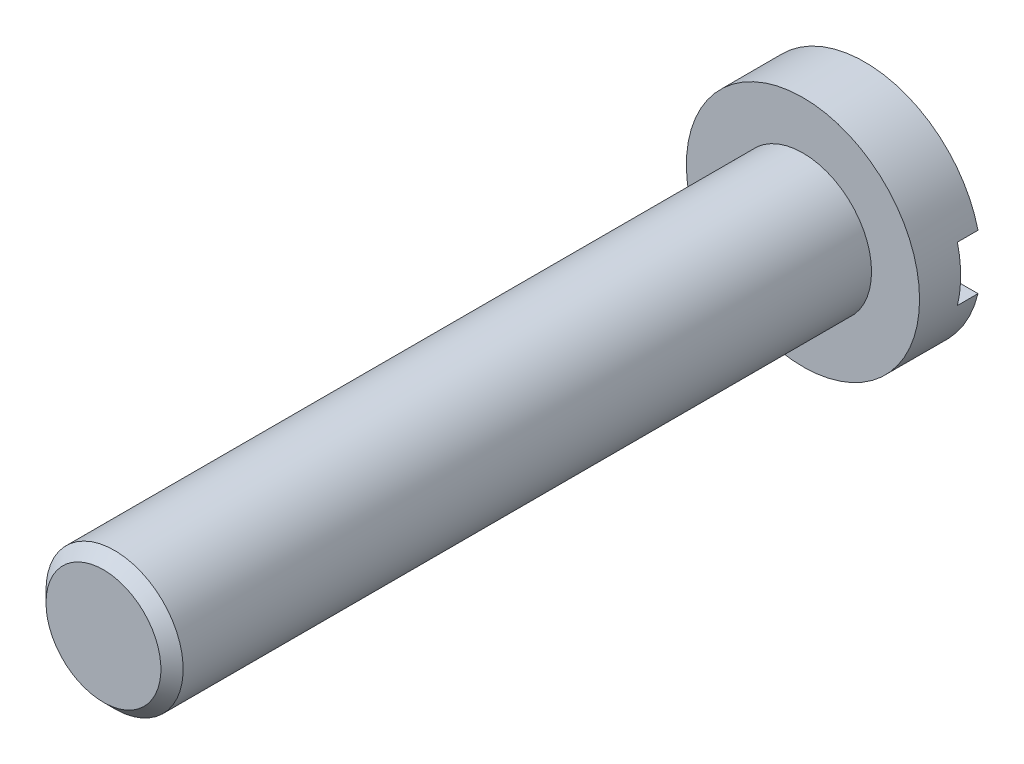
from build123d import *

# Parameters (mm, degrees)
SKETCH_1_R               = 8.5
EXTRUDE_1_DEPTH          = 4.5
SKETCH_2_R               = 5
EXTRUDE_2_DEPTH          = 55.5
CUT_EXTRUDE_1_DEPTH      = 57.786882288
CUT_EXTRUDE_1_DEPTH_BACK = 1.5
SKETCH_5_W               = 17
SKETCH_5_H               = 4


# Read off the part's stored shape, not the designer's step: M10 机械螺纹 螺柱1
with BuildPart() as part:
    # 草图1 → 凸台-拉伸1 (new body)
    with BuildSketch(Plane.XY):
        Circle(SKETCH_1_R)
    extrude(amount=EXTRUDE_1_DEPTH)

    # 草图2 → 凸台-拉伸2 (add)
    with BuildSketch(Plane.XY):
        Circle(SKETCH_2_R)
    extrude(amount=EXTRUDE_2_DEPTH)

    # M10 机械螺纹 螺柱1 outline → M10 机械螺纹 螺柱1 (revolve, cut)
    with BuildSketch(Plane.XZ):
        Polygon((5, 55.5), (4.188, 55.5), (5, 54.688), align=None)
    revolve(axis=Axis((0, 0, 0), (0, 0, 1)), mode=Mode.SUBTRACT)

    # 草图5 → 切除-拉伸-薄壁1 (cut, two sides: drawn at the far end of the back side and taken through both)
    with BuildSketch(Plane(origin=(0, 0, 0), x_dir=(-1, 0, 0), z_dir=(0, 0, -1)).offset(-CUT_EXTRUDE_1_DEPTH_BACK)):
        Rectangle(SKETCH_5_W, SKETCH_5_H)
    extrude(amount=CUT_EXTRUDE_1_DEPTH + CUT_EXTRUDE_1_DEPTH_BACK, mode=Mode.SUBTRACT)


solid = part.part
